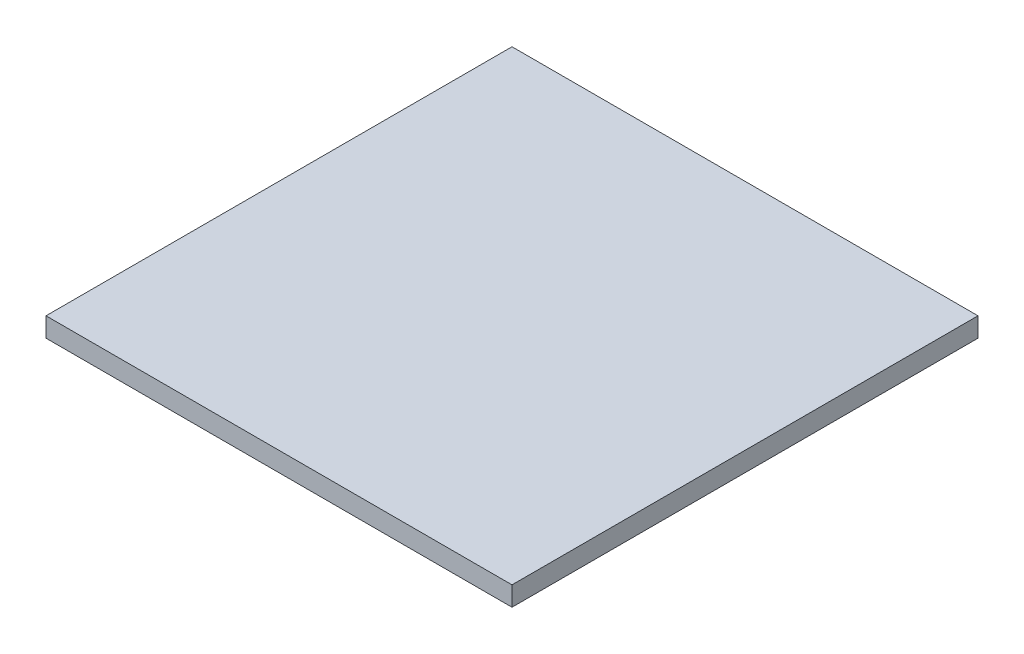
from build123d import *

# Parameters (mm, degrees)
SKETCH1_W           = 152.4
SKETCH1_H           = 152.4
BOSS_EXTRUDE1_DEPTH = 6.35


with BuildPart() as part:
    # Sketch1 → Boss-Extrude1 (new body)
    with BuildSketch(Plane(origin=(0, 0, 0), x_dir=(1, 0, 0), z_dir=(0, 1, 0))):
        Rectangle(SKETCH1_W, SKETCH1_H)
    extrude(amount=BOSS_EXTRUDE1_DEPTH)


solid = part.part
